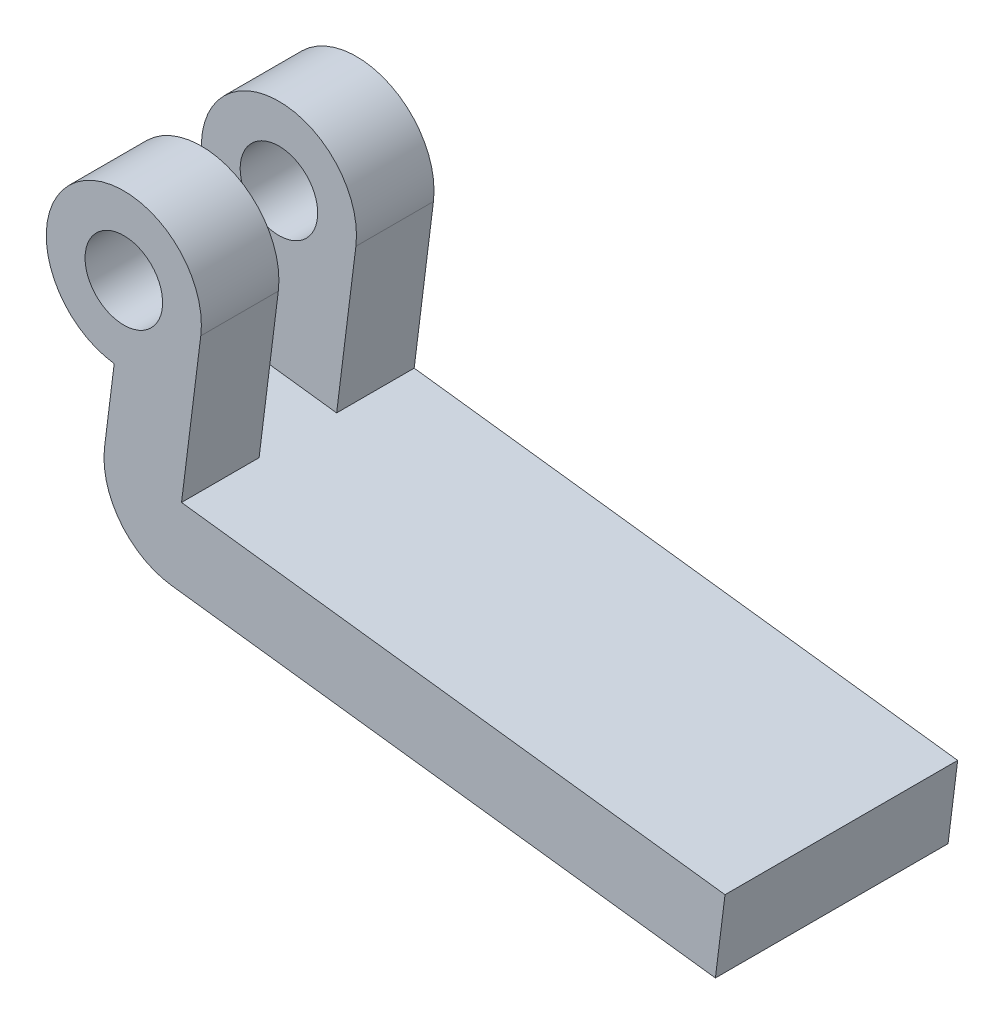
from build123d import *

# Parameters (mm, degrees)
SKETCH1_R           = 3.175
BOSS_EXTRUDE1_DEPTH = 9.525
CUT_EXTRUDE1_START  = -6.35
CUT_EXTRUDE1_DEPTH  = 6.35
FILLET1_R           = 6.35


with BuildPart() as part:
    # Sketch1 → Boss-Extrude1 (new, symmetric)
    with BuildSketch(Plane.XY):
        with BuildLine():
            Line((6.300964517, -0.787620565), (4.725723388, -13.389549599))
            Line((4.725723388, -13.389549599), (49.224758871, -18.951929034))
            Line((49.224758871, -18.951929034), (48.437138306, -25.252893551))
            Line((48.437138306, -25.252893551), (-2.362861694, -18.902893551))
            Line((-2.362861694, -18.902893551), (-0.787620565, -6.300964517))
            ThreePointArc((-0.787620565, -6.300964517), (-3.898522896, 5.01238658), (6.300964517, -0.787620565))
        make_face()
        with Locations(Location((0, 0, 0), (0, 0, 180))):
            Circle(SKETCH1_R, mode=Mode.SUBTRACT)
    extrude(amount=BOSS_EXTRUDE1_DEPTH, both=True)

    # Sketch2 → Cut-Extrude1 (cut)
    with BuildSketch(Plane.XY.offset(9.525).offset(CUT_EXTRUDE1_START)):
        Polygon((49.224758871, -18.951929034), (-15.764537124, -10.828267035), (-12.959816333, 11.60949929), (52.029479661, 3.485837291), align=None)
    extrude(amount=-CUT_EXTRUDE1_DEPTH, mode=Mode.SUBTRACT)

    # Fillet1
    fillet1_edges = [part.edges().sort_by_distance(p)[0] for p in [
        (-2.362861694, -18.902893551, 0),
    ]]
    fillet(fillet1_edges, radius=FILLET1_R - 0.0001)  # a hair under: the kernel refuses the full size


solid = part.part
